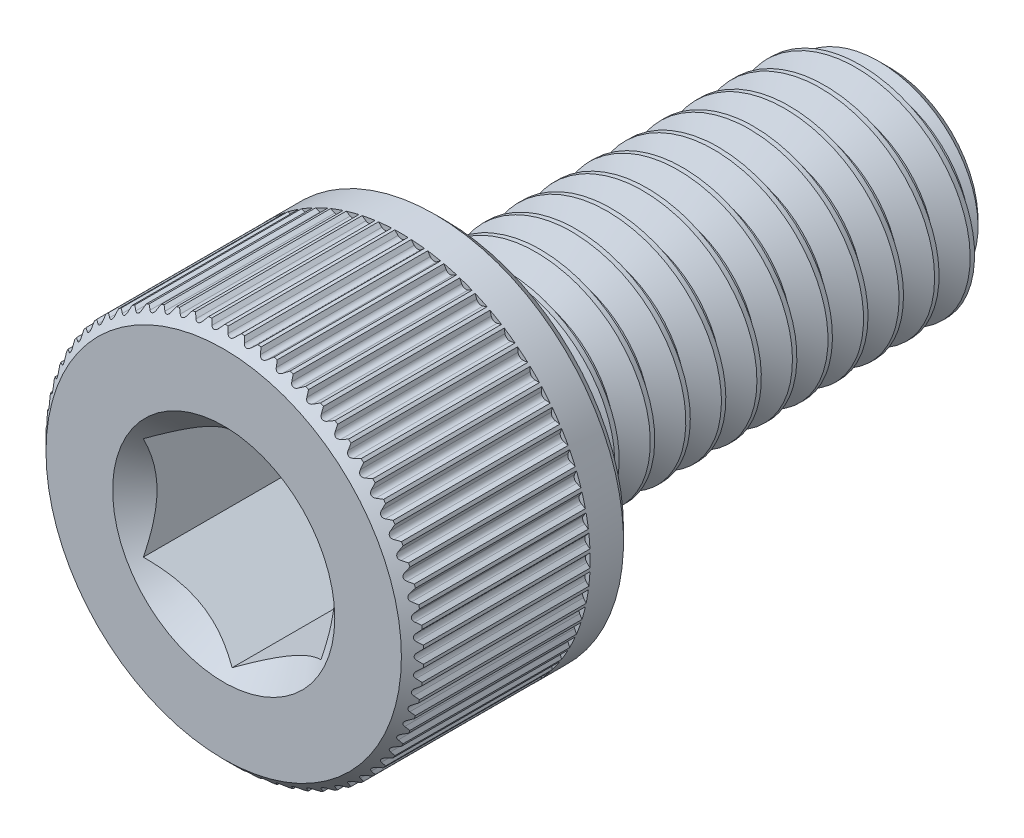
from build123d import *

# Parameters (mm, degrees)
CUT_EXTRUDE1_DEPTH     = 4
SPLIT1_SURFACE_1_BACK  = 20.222
SPLIT1_SURFACE_1_DEPTH = 40.444
SPLIT1_SURFACE_2_BACK  = 20.222
SPLIT1_SURFACE_2_DEPTH = 40.444
CUT_SWEEP1_PITCH       = 0.8
CUT_EXTRUDE3_DEPTH     = 4
CIRPATTERN1_COUNT      = 72


with BuildPart() as part:
    # Sketch2 → Revolve1 (revolve)
    with BuildSketch(Plane(origin=(0, 0, 0), x_dir=(0, 0, -1), z_dir=(1, 0, 0))):
        with BuildLine():
            Line((-7.5, 0), (-7.5, 4))
            Line((-7.5, 4), (-7.25, 4.25))
            Line((-7.25, 4.25), (-2.75, 4.25))
            Line((-2.75, 4.25), (-2.5, 4))
            Line((-2.5, 4), (-2.5, 2.75))
            ThreePointArc((-2.5, 2.75), (-2.426776695, 2.573223305), (-2.25, 2.5))
            Line((-2.25, 2.5), (6.980384758, 2.5))
            Line((6.980384758, 2.5), (7.5, 1.980384758))
            Line((7.5, 1.980384758), (7.5, 0))
            Line((7.5, 0), (-7.5, 0))
        make_face()
    revolve(axis=Axis((0, 0, -7.5), (0, 0, 1)))

    # Sketch3 → Cut-Extrude1 (cut)
    with BuildSketch(Plane.XY.offset(7.5)):
        Polygon((2, -1.154700538), (2, 1.154700538), (0, 2.309401077), (-2, 1.154700538), (-2, -1.154700538), (0, -2.309401077), align=None)
    extrude(amount=-CUT_EXTRUDE1_DEPTH, mode=Mode.SUBTRACT)

    # Cut-Extrude2 cone 1 section (through the dimple's axis) → Cut-Extrude2 (revolve, cut)
    with BuildSketch(Plane(origin=(0, 0, 7.5), x_dir=(0, -1, 0), z_dir=(1, 0, 0))):
        Polygon((0, 0), (2.5, 0), (0, 2.5), align=None)
    revolve(axis=Axis((0, 0, 7.5), (0, 0, -1)), mode=Mode.SUBTRACT)


with BuildPart() as body_2:
    # Split1: the piece behind the surface
    add(part.part)
    # Split1 surface: a surface, the sketch's curves swept straight by 40.444 mm
    with BuildLine(Plane(origin=(0, 0, 0), x_dir=(0, 0, -1), z_dir=(1, 0, 0)).offset(-SPLIT1_SURFACE_1_BACK), mode=Mode.PRIVATE) as split1_surface_1_path:
        Line((-2.25, -4.25), (-2.25, 4.25))
    split1_surface_1 = Shell.extrude(split1_surface_1_path.wire(), (1 * SPLIT1_SURFACE_1_DEPTH, 0 * SPLIT1_SURFACE_1_DEPTH, 0 * SPLIT1_SURFACE_1_DEPTH))
    split(bisect_by=split1_surface_1, keep=Keep.BOTTOM)

    # Cut-Sweep1: the profile of Sketch7 screwed along a right-hand helix of 13.5 turns, 8 arcs to a turn; built about Z, then put on its axis
    cut_sweep1_z = Axis((0, 0, 0), (0, 0, 1))
    cut_sweep1_corners = [(2.54330127, 0, 0.025), (2.54330127, 0, -0.725), (1.980384758, 0, -0.4), (1.980384758, 0, -0.3)]
    with BuildLine(mode=Mode.PRIVATE) as cut_sweep1_profile:
        Line(cut_sweep1_corners[0], cut_sweep1_corners[1])
        Line(cut_sweep1_corners[1], cut_sweep1_corners[2])
        Line(cut_sweep1_corners[2], cut_sweep1_corners[3])
        Line(cut_sweep1_corners[3], cut_sweep1_corners[0])
    cut_sweep1_cap = Face(cut_sweep1_profile.wire())
    cut_sweep1_turn_angles = [0, 22.5, 45, 67.5, 90, 112.5, 135, 157.5, 180, 202.5, 225, 247.5, 270, 292.5, 315, 337.5, 360]
    cut_sweep1_turn_weights = [1, 0.9238795325112867, 1, 0.9238795325112867, 1, 0.9238795325112867, 1, 0.9238795325112867, 1, 0.9238795325112867, 1, 0.9238795325112867, 1, 0.9238795325112867, 1, 0.9238795325112867, 1]
    cut_sweep1_turn_rails = [Edge.make_bspline([Vector(p[0], p[1], 0).rotate(cut_sweep1_z, cut_sweep1_turn_angles[k]) / cut_sweep1_turn_weights[k] + Vector(0, 0, p[2] + CUT_SWEEP1_PITCH * cut_sweep1_turn_angles[k] / 360) for k in range(17)], [0, 0, 0, 1, 1, 2, 2, 3, 3, 4, 4, 5, 5, 6, 6, 7, 7, 8, 8, 8], 2, cut_sweep1_turn_weights) for p in cut_sweep1_corners]
    cut_sweep1_turn_sides = [Face.make_surface_from_curves(cut_sweep1_turn_rails[p[0]], cut_sweep1_turn_rails[p[1]]) for p in [(0, 1), (1, 2), (2, 3), (3, 0)]]
    cut_sweep1_last_angles = [4680, 4702.5, 4725, 4747.5, 4770, 4792.5, 4815, 4837.5, 4860]
    cut_sweep1_last_weights = [1, 0.9238795325112867, 1, 0.9238795325112867, 1, 0.9238795325112867, 1, 0.9238795325112139, 1]
    cut_sweep1_last_rails = [Edge.make_bspline([Vector(p[0], p[1], 0).rotate(cut_sweep1_z, cut_sweep1_last_angles[k]) / cut_sweep1_last_weights[k] + Vector(0, 0, p[2] + CUT_SWEEP1_PITCH * cut_sweep1_last_angles[k] / 360) for k in range(9)], [0, 0, 0, 1, 1, 2, 2, 3, 3, 4, 4, 4], 2, cut_sweep1_last_weights) for p in cut_sweep1_corners]
    cut_sweep1_last_sides = [Face.make_surface_from_curves(cut_sweep1_last_rails[p[0]], cut_sweep1_last_rails[p[1]]) for p in [(0, 1), (1, 2), (2, 3), (3, 0)]]
    cut_sweep1 = Plane(origin=(0, 0, -7.5), x_dir=(0, 1, 0), z_dir=(0, 0, 1)) * Solid(Shell([*[p.moved(Location((0, 0, CUT_SWEEP1_PITCH * i))) for i in range(13) for p in cut_sweep1_turn_sides], *cut_sweep1_last_sides, cut_sweep1_cap, cut_sweep1_cap.rotate(cut_sweep1_z, 4860).moved(Location((0, 0, CUT_SWEEP1_PITCH * 4860 / 360)))]))
    add(cut_sweep1, mode=Mode.SUBTRACT)


with BuildPart() as part_1:
    add(part.part)

    # Split1: split by a surface, the side it looks to stays
    # Split1 surface: a surface, the sketch's curves swept straight by 40.444 mm
    with BuildLine(Plane(origin=(0, 0, 0), x_dir=(0, 0, -1), z_dir=(1, 0, 0)).offset(-SPLIT1_SURFACE_2_BACK), mode=Mode.PRIVATE) as split1_surface_2_path:
        Line((-2.25, -4.25), (-2.25, 4.25))
    split1_surface_2 = Shell.extrude(split1_surface_2_path.wire(), (1 * SPLIT1_SURFACE_2_DEPTH, 0 * SPLIT1_SURFACE_2_DEPTH, 0 * SPLIT1_SURFACE_2_DEPTH))
    split(bisect_by=split1_surface_2, keep=Keep.TOP)

    add(body_2.part)  # Revolve2 merges body 2
    # Sketch8 → Revolve2 (revolve)
    with BuildSketch(Plane(origin=(0, 0, 0), x_dir=(0, 0, -1), z_dir=(1, 0, 0)), mode=Mode.PRIVATE) as revolve2_sk:
        Polygon((-2.5, 0), (-2.5, 2.5), (-2.25, 2.5), (-0.806624327, 0), align=None)
    revolve(revolve2_sk.sketch.rotate(Axis((0, 0, 0.806624327), (0, 0, 1)), 270), axis=Axis((0, 0, 0.806624327), (0, 0, 1)))

    # Sketch12 → Cut-Extrude3 (cut)
    with BuildSketch(Plane.XY.offset(7.5)):
        with BuildLine():
            Line((-0.257161846, 4.35625), (0.257161846, 4.35625))
            Line((0.257161846, 4.35625), (0.07624254, 4.175330694))
            ThreePointArc((0.07624254, 4.175330694), (0, 4.14375), (-0.07624254, 4.175330694))
            Line((-0.07624254, 4.175330694), (-0.257161846, 4.35625))
        make_face()
    cut_extrude3 = extrude(amount=-CUT_EXTRUDE3_DEPTH, mode=Mode.SUBTRACT)

    # CirPattern1: Cut-Extrude3 ×72 about axis
    cirpattern1_axis = Axis((0, 0, 0), (0, 0, 1))
    for i in range(1, CIRPATTERN1_COUNT):
        add(cut_extrude3.rotate(cirpattern1_axis, i * 360 / CIRPATTERN1_COUNT), mode=Mode.SUBTRACT)


solid = part_1.part
